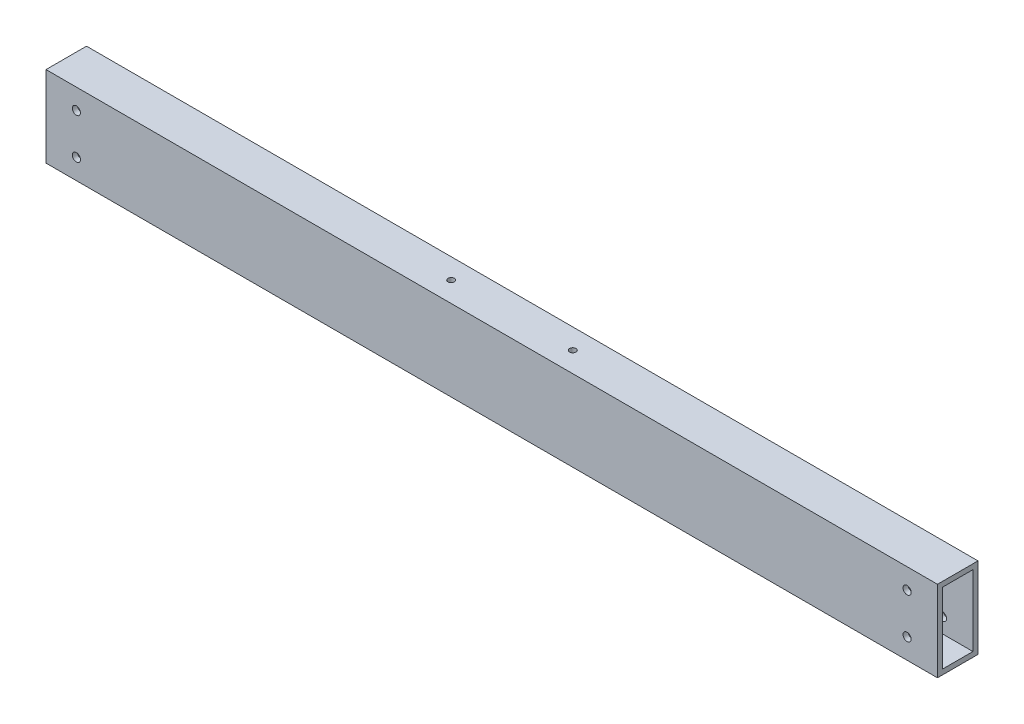
from build123d import *

# Parameters (mm, degrees)
SKETCH1_W                           = 558.8
SKETCH1_H                           = 50.8
BOSS_EXTRUDE1_DEPTH                 = 12.7
SKETCH2_W                           = 19.05
SKETCH2_H                           = 44.45
CUT_EXTRUDE1_DEPTH                  = 560.521125607
F_1_4_20_TAPPED_HOLE1_D             = 5.1054
F_10_32_TAPPED_HOLE1_D              = 4.0386
F_10_32_TAPPED_HOLE1_DEPTH          = 5.08
F_10_32_TAPPED_HOLE1_TIP            = 1.213317848
F_5_32_0_15625_DIAMETER_HOLE1_D     = 3.96875
F_5_32_0_15625_DIAMETER_HOLE1_DEPTH = 5.08
F_5_32_0_15625_DIAMETER_HOLE1_TIP   = 1.192332791


with BuildPart() as part:
    # Sketch1 → Boss-Extrude1 (new, symmetric)
    with BuildSketch(Plane.XY):
        Rectangle(SKETCH1_W, SKETCH1_H)
    extrude(amount=BOSS_EXTRUDE1_DEPTH, both=True)

    # Sketch2 → Cut-Extrude1 (cut, through all)
    with BuildSketch(Plane(origin=(279.4, 0, 0), x_dir=(0, 0, -1), z_dir=(1, 0, 0))):
        Rectangle(SKETCH2_W, SKETCH2_H)
    extrude(amount=-CUT_EXTRUDE1_DEPTH, mode=Mode.SUBTRACT)

    # 1/4-20 Tapped Hole1 (through all)
    with Locations(Plane.XY.offset(12.7)):
        with Locations((-260.35, 12.7), (-260.35, -12.7), (260.35, 12.7), (260.35, -12.7)):
            Hole(F_1_4_20_TAPPED_HOLE1_D / 2)

    # #10-32 Tapped Hole1
    with Locations(Plane(origin=(0, 0, -12.7), x_dir=(-1, 0, 0), z_dir=(0, 0, -1))):
        with Locations((-190.5, -13.49375), (-114.3, -13.49375), (-38.1, -13.49375), (38.1, -13.49375), (114.3, -13.49375), (190.5, -13.49375)):
            Hole(F_10_32_TAPPED_HOLE1_D / 2, depth=F_10_32_TAPPED_HOLE1_DEPTH)
            with Locations((0, 0, -(F_10_32_TAPPED_HOLE1_DEPTH + F_10_32_TAPPED_HOLE1_TIP / 2))):  # 118° drill point
                Cone(0, F_10_32_TAPPED_HOLE1_D / 2, F_10_32_TAPPED_HOLE1_TIP, mode=Mode.SUBTRACT)

    # 5/32 (0.15625) Diameter Hole1
    with Locations(Plane(origin=(0, 25.4, 0), x_dir=(1, 0, 0), z_dir=(0, 1, 0))):
        with Locations((-38.1, 0), (38.1, 0)):
            Hole(F_5_32_0_15625_DIAMETER_HOLE1_D / 2, depth=F_5_32_0_15625_DIAMETER_HOLE1_DEPTH)
            with Locations((0, 0, -(F_5_32_0_15625_DIAMETER_HOLE1_DEPTH + F_5_32_0_15625_DIAMETER_HOLE1_TIP / 2))):  # 118° drill point
                Cone(0, F_5_32_0_15625_DIAMETER_HOLE1_D / 2, F_5_32_0_15625_DIAMETER_HOLE1_TIP, mode=Mode.SUBTRACT)


solid = part.part
